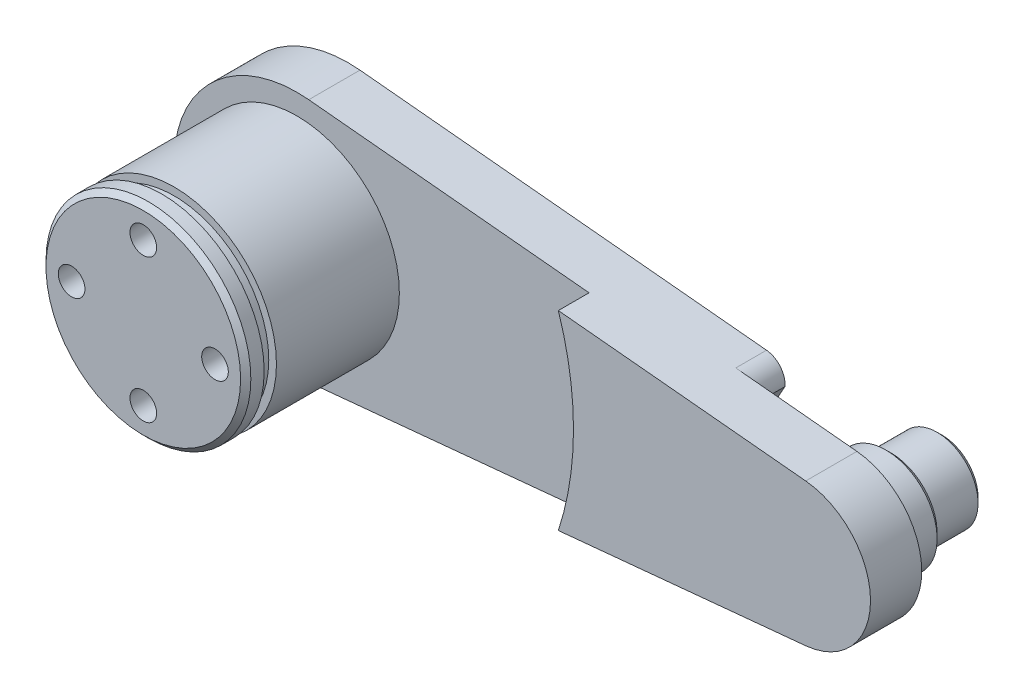
from build123d import *
from build123d.topology import SkipClean

# Parameters (mm, degrees)
EXTRUDE_1_DEPTH     = 5
SKETCH_2_R          = 10
EXTRUDE_2_DEPTH     = 15
SKETCH_3_R          = 4
EXTRUDE_3_DEPTH     = 6
SKETCH_4_R          = 5
SKETCH_4_R_2        = 4
EXTRUDE_4_DEPTH     = 1
CHAMFER_1_SIZE      = 0.5
SKETCH_6_R          = 1.3
CUT_EXTRUDE_2_DEPTH = 6
SKETCH_11_R         = 2.2
CUT_EXTRUDE_7_DEPTH = 10
CUT_EXTRUDE_START   = -5
CUT_EXTRUDE_8_DEPTH = 5
SKETCH_14_R         = 5
CUT_EXTRUDE_9_DEPTH = 3
EXTRUDE_START       = -1
SKETCH_15_R         = 10
EXTRUDE_5_DEPTH     = 1
FILLET_1_R          = 2
SKETCH_16_W         = 4.663078912
SKETCH_16_H         = 1.2
EXTRUDE_6_DEPTH     = 4
EXTRUDE_START_2     = 1
EXTRUDE_7_DEPTH     = 1
EXTRUDE_8_DEPTH     = 3


with BuildPart() as part:
    # 草图1 → 凸台-拉伸1 (new body)
    with BuildSketch(Plane.XY):
        with BuildLine():
            Line((52.673076923, 6.967565389), (1.153846154, 11.94439781))
            ThreePointArc((1.153846154, 11.94439781), (-12, 0), (1.153846154, -11.94439781))
            Line((1.153846154, -11.94439781), (52.673076923, -6.967565389))
            ThreePointArc((52.673076923, -6.967565389), (59, 0), (52.673076923, 6.967565389))
        make_face()
    extrude(amount=EXTRUDE_1_DEPTH)

    # 草图2 → 凸台-拉伸2 (add)
    with BuildSketch(Plane.XY.offset(5)):
        Circle(SKETCH_2_R)
    extrude(amount=EXTRUDE_2_DEPTH)

    # 草图3 → 凸台-拉伸3 (add)
    with BuildSketch(Plane(origin=(0, 0, 0), x_dir=(-1, 0, 0), z_dir=(0, 0, -1))):
        with Locations((-52, 0)):
            Circle(SKETCH_3_R)
    extrude(amount=EXTRUDE_3_DEPTH)

    # 草图4 → 凸台-拉伸4 (add)
    with BuildSketch(Plane(origin=(0, 0, 0), x_dir=(-1, 0, 0), z_dir=(0, 0, -1))):
        with Locations(Location((-52, 0, 0), (0, 0, 180))):
            Circle(SKETCH_4_R)
        with Locations((-52, 0)):
            Circle(SKETCH_4_R_2, mode=Mode.SUBTRACT)
    extrude(amount=EXTRUDE_4_DEPTH)

    # 倒角1
    chamfer_1_edges = [part.edges().sort_by_distance(p)[0] for p in [
        (-10, 0, 20),
        (56, 0, -6),
        (47, 0, -1),
    ]]
    chamfer(chamfer_1_edges, length=CHAMFER_1_SIZE)

    # 草图6 → 切除-拉伸2 (cut)
    with BuildSketch(Plane.XY.offset(20)):
        with Locations((0, 7)):
            Circle(SKETCH_6_R)
        with Locations((7, 0)):
            Circle(SKETCH_6_R)
        with Locations((0, -7)):
            Circle(SKETCH_6_R)
        with Locations((-7, 0)):
            Circle(SKETCH_6_R)
    extrude(amount=-CUT_EXTRUDE_2_DEPTH, mode=Mode.SUBTRACT)

    # 草图11 → 切除-拉伸7 (cut)
    with BuildSketch(Plane(origin=(0, 0, -6), x_dir=(-1, 0, 0), z_dir=(0, 0, -1))):
        with Locations((-52, 0)):
            Circle(SKETCH_11_R)
    extrude(amount=-CUT_EXTRUDE_7_DEPTH, mode=Mode.SUBTRACT)

    # 草图12 → 切除-拉伸8 (cut)
    with BuildSketch(Plane.XY.offset(5).offset(CUT_EXTRUDE_START)):
        with BuildLine():
            Line((47.604489244, 5.447888141), (7.564052776, 9.315852382))
            ThreePointArc((7.564052776, 9.315852382), (10.834404305, 5.159038995), (12, 0))
            ThreePointArc((12, 0), (10.834404305, -5.159038995), (7.564052776, -9.315852382))
            Line((7.564052776, -9.315852382), (47.604489244, -5.447888141))
            ThreePointArc((47.604489244, -5.447888141), (45, 0), (47.604489244, 5.447888141))
        make_face()
    extrude(amount=CUT_EXTRUDE_8_DEPTH, mode=Mode.SUBTRACT)

    # 草图14 → 切除-拉伸9 (cut)
    # profile 1 of 2: a face of its own
    with BuildSketch(Plane(origin=(0, 0, 0), x_dir=(-1, 0, 0), z_dir=(0, 0, -1))):
        with BuildLine():
            Line((-52.673076923, 6.967565389), (-44.130557544, 7.792785152))
            ThreePointArc((-44.130557544, 7.792785152), (-63.075, 0), (-44.130557544, -7.792785152))
            Line((-44.130557544, -7.792785152), (-52.673076923, -6.967565389))
            ThreePointArc((-52.673076923, -6.967565389), (-59, 0), (-52.673076923, 6.967565389))
        make_face()
    # profile 2 of 2: a face of its own
    with BuildSketch(Plane(origin=(0, 0, 0), x_dir=(-1, 0, 0), z_dir=(0, 0, -1))):
        with BuildLine():
            ThreePointArc((-44.130557544, -7.792785152), (-41.757693126, -4.213166849), (-40.925, 0))
            ThreePointArc((-40.925, 0), (-41.757693126, 4.213166849), (-44.130557544, 7.792785152))
            Line((-44.130557544, 7.792785152), (-52.673076923, 6.967565389))
            ThreePointArc((-52.673076923, 6.967565389), (-59, 0), (-52.673076923, -6.967565389))
            Line((-52.673076923, -6.967565389), (-44.130557544, -7.792785152))
        make_face()
        with Locations((-52, 0)):
            Circle(SKETCH_14_R, mode=Mode.SUBTRACT)
    extrude(amount=-CUT_EXTRUDE_9_DEPTH, mode=Mode.SUBTRACT)

    # 草图15 → 凸台-拉伸5 (add)
    # profile 1 of 2: a face of its own
    with SkipClean():  # the faces are left unmerged after this step: merging them gives an invalid solid
        with BuildSketch(Plane.XY.offset(5).offset(EXTRUDE_START)):
            with BuildLine():
                ThreePointArc((1.153846154, 11.94439781), (-12, 0), (1.153846154, -11.94439781))
                Line((1.153846154, -11.94439781), (52.673076923, -6.967565389))
                ThreePointArc((52.673076923, -6.967565389), (59, 0), (52.673076923, 6.967565389))
                Line((52.673076923, 6.967565389), (1.153846154, 11.94439781))
            make_face()
            Circle(SKETCH_15_R, mode=Mode.SUBTRACT)
            with BuildLine():
                ThreePointArc((7.564052776, -9.315852382), (12, 0), (7.564052776, 9.315852382))
                Line((7.564052776, 9.315852382), (47.604489244, 5.447888141))
                ThreePointArc((47.604489244, 5.447888141), (45, 0), (47.604489244, -5.447888141))
                Line((47.604489244, -5.447888141), (7.564052776, -9.315852382))
            make_face(mode=Mode.SUBTRACT)
        # profile 2 of 2: a face of its own
        with BuildSketch(Plane.XY.offset(5).offset(EXTRUDE_START)):
            with BuildLine():
                Line((47.604489244, 5.447888141), (7.564052776, 9.315852382))
                ThreePointArc((7.564052776, 9.315852382), (12, 0), (7.564052776, -9.315852382))
                Line((7.564052776, -9.315852382), (47.604489244, -5.447888141))
                ThreePointArc((47.604489244, -5.447888141), (45, 0), (47.604489244, 5.447888141))
            make_face()
        extrude(amount=EXTRUDE_5_DEPTH)
    add(part.part.scale(1), mode=Mode.REPLACE)  # the faces are merged on a copy

    # 圆角1
    # the kernel refuses this fillet: 2 mm, written as the material it takes off along each edge
    with BuildSketch(Plane(origin=(44.130557544, -7.792785152, -8.249501326), x_dir=(-0.9953664842005795, -0.09615384615384645, 0), z_dir=(0, 0, 1)), Plane(origin=(44.130557544, 7.792785152, 3), x_dir=(-0.9953664842005796, 0.09615384615384538, 0), z_dir=(0, 0, -1))) as fillet_1_piece_1:
        with BuildLine():
            CenterArc((3.29980053, -2), FILLET_1_R, 90, 90)
            ThreePointArc((1.29980053, -2), (0.703900692, -0.964905108), (0, 0))
            Line((0, 0), (3.29980053, 0))
        make_face()
    extrude(amount=11.249501326, mode=Mode.SUBTRACT)

    # 草图16 → 切除-旋转1 (revolve, cut)
    with BuildSketch(Plane(origin=(0, 0, 0), x_dir=(1, 0, 0), z_dir=(0, 1, 0))):
        with Locations((11.581539456, -17.6)):
            Rectangle(SKETCH_16_W, SKETCH_16_H)
    revolve(axis=Axis((0, 0, 20), (0, 0, -1)), mode=Mode.SUBTRACT)

    # 草图17 → 凸台-拉伸6 (add)
    with BuildSketch(Plane(origin=(0, 0, 4), x_dir=(-1, 0, 0), z_dir=(0, 0, -1))):
        with BuildLine():
            Line((-7.564052776, 9.315852382), (-42.644471967, 5.927033004))
            ThreePointArc((-42.644471967, 5.927033004), (-40.925, 0), (-42.644471967, -5.927033004))
            Line((-42.644471967, -5.927033004), (-7.564052776, -9.315852382))
            ThreePointArc((-7.564052776, -9.315852382), (-12, 0), (-7.564052776, 9.315852382))
        make_face()
        with BuildLine():
            Line((-38.644471967, 2.294818465), (-38.644471967, -2.294818465))
            Line((-38.644471967, -2.294818465), (-15.340593905, -4.546006888))
            ThreePointArc((-15.340593905, -4.546006888), (-16, 0), (-15.340593905, 4.546006888))
            Line((-15.340593905, 4.546006888), (-38.644471967, 2.294818465))
        make_face(mode=Mode.SUBTRACT)
    extrude(amount=EXTRUDE_6_DEPTH)

    # 草图18 → 凸台-拉伸7 (add)
    with BuildSketch(Plane(origin=(0, 0, 4), x_dir=(-1, 0, 0), z_dir=(0, 0, -1)).offset(EXTRUDE_START_2)):
        with BuildLine():
            Line((-42.644471967, 5.927033004), (-47.604489244, 5.447888141))
            ThreePointArc((-47.604489244, 5.447888141), (-45, 0), (-47.604489244, -5.447888141))
            Line((-47.604489244, -5.447888141), (-42.644471967, -5.927033004))
            ThreePointArc((-42.644471967, -5.927033004), (-40.925, 0), (-42.644471967, 5.927033004))
        make_face()
    extrude(amount=-EXTRUDE_7_DEPTH)

    # 草图19 → 凸台-拉伸8 (add)
    with BuildSketch(Plane.XY.offset(5)):
        with BuildLine():
            Line((28.521899702, -9.30060414), (52.673076923, -6.967565389))
            ThreePointArc((52.673076923, -6.967565389), (59, 0), (52.673076923, 6.967565389))
            Line((52.673076923, 6.967565389), (28.521899702, 9.30060414))
            ThreePointArc((28.521899702, 9.30060414), (30, 0), (28.521899702, -9.30060414))
        make_face()
    extrude(amount=EXTRUDE_8_DEPTH)


solid = part.part
